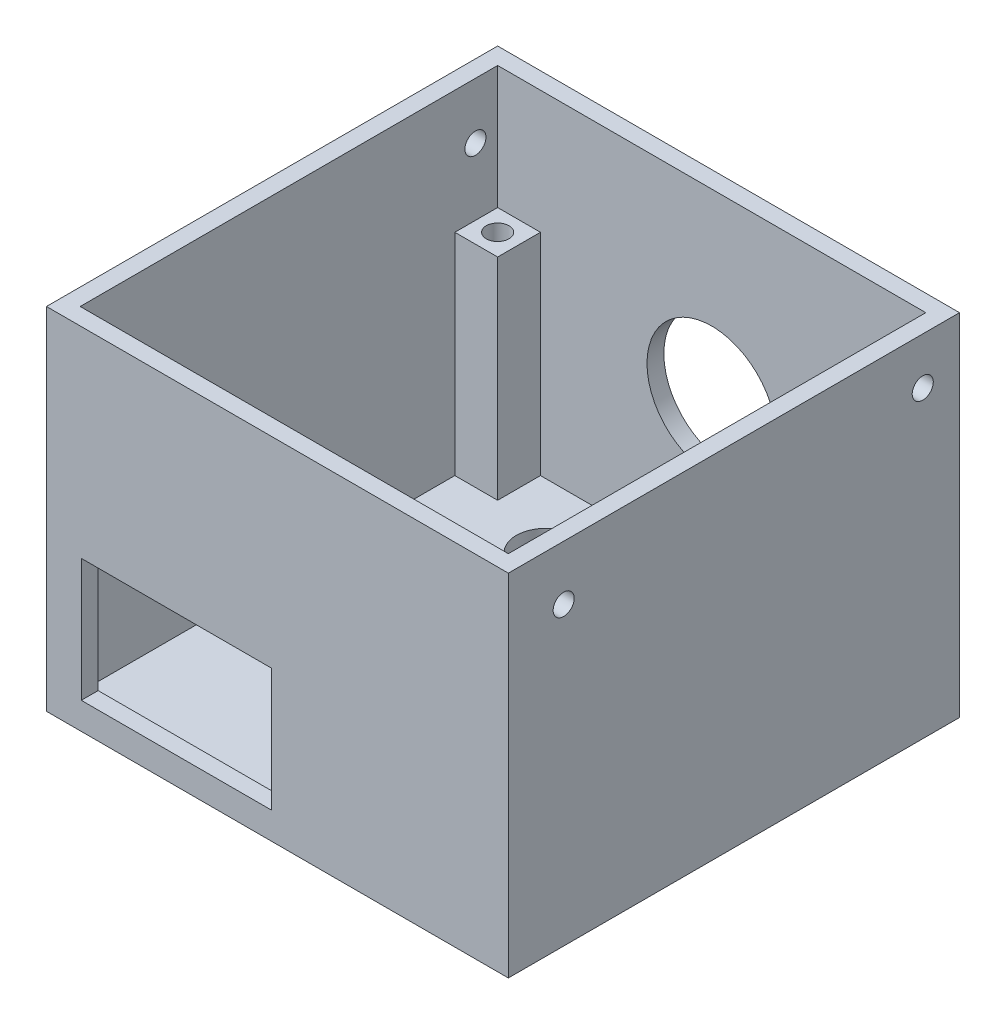
from build123d import *

# Parameters (mm, degrees)
SKETCH1_W           = 54.8
SKETCH1_H           = 53.53
BOSS_EXTRUDE1_DEPTH = 41.6
SKETCH2_W           = 50.8
SKETCH2_H           = 49.53
CUT_EXTRUDE1_DEPTH  = 39.6
SKETCH3_W           = 5.08
SKETCH3_H           = 5.08
BOSS_EXTRUDE2_DEPTH = 25
SKETCH4_R           = 1.35
CUT_EXTRUDE2_DEPTH  = 10
CUT_EXTRUDE3_REACH  = 58.548
SKETCH5_R           = 3.5
CUT_EXTRUDE4_REACH  = 58.548
SKETCH6_R           = 3.1
CUT_EXTRUDE5_REACH  = 58.548
SKETCH7_R           = 3.6
CUT_EXTRUDE6_REACH  = 75.824
SKETCH8_R           = 1.25
CUT_EXTRUDE7_REACH  = 75.824
SKETCH10_R          = 1.25
CUT_EXTRUDE8_REACH  = 75.122
SKETCH12_R          = 7.680495542
CUT_EXTRUDE9_REACH  = 75.122
SKETCH13_W          = 22.581735489
SKETCH13_H          = 14.589690318
CUT_EXTRUDE10_REACH = 75.824
SKETCH14_R          = 1.25


with BuildPart() as part:
    # Sketch1 → Boss-Extrude1 (new body)
    with BuildSketch(Plane(origin=(0, 0, 0), x_dir=(1, 0, 0), z_dir=(0, 1, 0))):
        Rectangle(SKETCH1_W, SKETCH1_H)
    extrude(amount=BOSS_EXTRUDE1_DEPTH)

    # Sketch2 → Cut-Extrude1 (cut)
    with BuildSketch(Plane(origin=(0, 41.6, 0), x_dir=(1, 0, 0), z_dir=(0, 1, 0))):
        Rectangle(SKETCH2_W, SKETCH2_H)
    extrude(amount=-CUT_EXTRUDE1_DEPTH, mode=Mode.SUBTRACT)

    # Sketch3 → Boss-Extrude2 (add)
    with BuildSketch(Plane(origin=(0, 2, 0), x_dir=(1, 0, 0), z_dir=(0, 1, 0))):
        with Locations((-22.86, 22.225)):
            Rectangle(SKETCH3_W, SKETCH3_H)
        with Locations((22.86, 22.225)):
            Rectangle(SKETCH3_W, SKETCH3_H)
        with Locations((22.86, -22.225)):
            Rectangle(SKETCH3_W, SKETCH3_H)
    extrude(amount=BOSS_EXTRUDE2_DEPTH)

    # Sketch4 → Cut-Extrude2 (cut)
    with BuildSketch(Plane(origin=(0, 27, 0), x_dir=(1, 0, 0), z_dir=(0, 1, 0))):
        with Locations((-22.86, 22.225)):
            Circle(SKETCH4_R)
        with Locations((22.86, 22.225)):
            Circle(SKETCH4_R)
        with Locations((22.86, -22.225)):
            Circle(SKETCH4_R)
    extrude(amount=-CUT_EXTRUDE2_DEPTH, mode=Mode.SUBTRACT)

    # Sketch5 → Cut-Extrude3 (cut, up to next)
    with BuildSketch(Plane(origin=(0, 0, 0), x_dir=(-1, 0, 0), z_dir=(0, -1, 0)), mode=Mode.PRIVATE) as cut_extrude3_sk1:
        with Locations((-12.762863618, 17.186859774)):
            Circle(SKETCH5_R)
    cut_extrude3_tool1 = extrude(cut_extrude3_sk1.sketch, amount=-CUT_EXTRUDE3_REACH, mode=Mode.PRIVATE) & part.part
    # Sketch5 → Cut-Extrude3 (cut, up to next)
    with BuildSketch(Plane(origin=(0, 0, 0), x_dir=(-1, 0, 0), z_dir=(0, -1, 0)), mode=Mode.PRIVATE) as cut_extrude3_sk2:
        with Locations((12.108357792, 17.186859774)):
            Circle(SKETCH5_R)
    cut_extrude3_tool2 = extrude(cut_extrude3_sk2.sketch, amount=-CUT_EXTRUDE3_REACH, mode=Mode.PRIVATE) & part.part
    add(cut_extrude3_tool1.solids().sort_by_distance((12.762864, 0, -17.18686))[0], mode=Mode.SUBTRACT)
    add(cut_extrude3_tool2.solids().sort_by_distance((-12.108358, 0, -17.18686))[0], mode=Mode.SUBTRACT)

    # Sketch6 → Cut-Extrude4 (cut, up to next)
    with BuildSketch(Plane(origin=(0, 0, 0), x_dir=(-1, 0, 0), z_dir=(0, -1, 0)), mode=Mode.PRIVATE) as cut_extrude4_sk1:
        with Locations((-16.908067186, 1.527180262)):
            Circle(SKETCH6_R)
    cut_extrude4_tool1 = extrude(cut_extrude4_sk1.sketch, amount=-CUT_EXTRUDE4_REACH, mode=Mode.PRIVATE) & part.part
    # Sketch6 → Cut-Extrude4 (cut, up to next)
    with BuildSketch(Plane(origin=(0, 0, 0), x_dir=(-1, 0, 0), z_dir=(0, -1, 0)), mode=Mode.PRIVATE) as cut_extrude4_sk2:
        with Locations((-8.726744354, 1.527180262)):
            Circle(SKETCH6_R)
    cut_extrude4_tool2 = extrude(cut_extrude4_sk2.sketch, amount=-CUT_EXTRUDE4_REACH, mode=Mode.PRIVATE) & part.part
    add(cut_extrude4_tool1.solids().sort_by_distance((16.908067, 0, -1.52718))[0], mode=Mode.SUBTRACT)
    add(cut_extrude4_tool2.solids().sort_by_distance((8.726744, 0, -1.52718))[0], mode=Mode.SUBTRACT)

    # Sketch7 → Cut-Extrude5 (cut, up to next)
    with BuildSketch(Plane(origin=(0, 0, 0), x_dir=(-1, 0, 0), z_dir=(0, -1, 0)), mode=Mode.PRIVATE) as cut_extrude5_sk1:
        with Locations((-12.653779314, -10.035756007)):
            Circle(SKETCH7_R)
    cut_extrude5_tool1 = extrude(cut_extrude5_sk1.sketch, amount=-CUT_EXTRUDE5_REACH, mode=Mode.PRIVATE) & part.part
    add(cut_extrude5_tool1.solids().sort_by_distance((12.653779, 0, 10.035756))[0], mode=Mode.SUBTRACT)

    # Sketch8 → Cut-Extrude6 (cut, up to next)
    with BuildSketch(Plane(origin=(27.4, 0, 0), x_dir=(0, 0, -1), z_dir=(1, 0, 0)), mode=Mode.PRIVATE) as cut_extrude6_sk1:
        with Locations((-20.200858991, 35.113292919)):
            Circle(SKETCH8_R)
    cut_extrude6_tool1 = extrude(cut_extrude6_sk1.sketch, amount=-CUT_EXTRUDE6_REACH, mode=Mode.PRIVATE) & part.part
    add(cut_extrude6_tool1.solids().sort_by_distance((27.4, 35.113293, 20.200859))[0], mode=Mode.SUBTRACT)

    # Sketch10 → Cut-Extrude7 (cut, up to next)
    with BuildSketch(Plane.ZY.offset(27.4), mode=Mode.PRIVATE) as cut_extrude7_sk1:
        with Locations((-22.126795963, 34.935427745)):
            Circle(SKETCH10_R)
    cut_extrude7_tool1 = extrude(cut_extrude7_sk1.sketch, amount=-CUT_EXTRUDE7_REACH, mode=Mode.PRIVATE) & part.part
    add(cut_extrude7_tool1.solids().sort_by_distance((-27.4, 34.935428, -22.126796))[0], mode=Mode.SUBTRACT)

    # Sketch12 → Cut-Extrude8 (cut, up to next)
    with BuildSketch(Plane(origin=(0, 0, -26.765), x_dir=(-1, 0, 0), z_dir=(0, 0, -1)), mode=Mode.PRIVATE) as cut_extrude8_sk1:
        with Locations((0, 19.850785186)):
            Circle(SKETCH12_R)
    cut_extrude8_tool1 = extrude(cut_extrude8_sk1.sketch, amount=-CUT_EXTRUDE8_REACH, mode=Mode.PRIVATE) & part.part
    add(cut_extrude8_tool1.solids().sort_by_distance((0, 19.850785, -26.765))[0], mode=Mode.SUBTRACT)

    # Sketch13 → Cut-Extrude9 (cut, up to next)
    with BuildSketch(Plane.XY.offset(26.765), mode=Mode.PRIVATE) as cut_extrude9_sk1:
        with Locations((-11.980612505, 10.491224969)):
            Rectangle(SKETCH13_W, SKETCH13_H)
    cut_extrude9_tool1 = extrude(cut_extrude9_sk1.sketch, amount=-CUT_EXTRUDE9_REACH, mode=Mode.PRIVATE) & part.part
    add(cut_extrude9_tool1.solids().sort_by_distance((-11.980613, 10.491225, 26.765))[0], mode=Mode.SUBTRACT)

    # Sketch14 → Cut-Extrude10 (cut, up to next)
    with BuildSketch(Plane(origin=(27.4, 0, 0), x_dir=(0, 0, -1), z_dir=(1, 0, 0)), mode=Mode.PRIVATE) as cut_extrude10_sk1:
        with Locations((22.403153775, 36.040667921)):
            Circle(SKETCH14_R)
    cut_extrude10_tool1 = extrude(cut_extrude10_sk1.sketch, amount=-CUT_EXTRUDE10_REACH, mode=Mode.PRIVATE) & part.part
    add(cut_extrude10_tool1.solids().sort_by_distance((27.4, 36.040668, -22.403154))[0], mode=Mode.SUBTRACT)


solid = part.part
